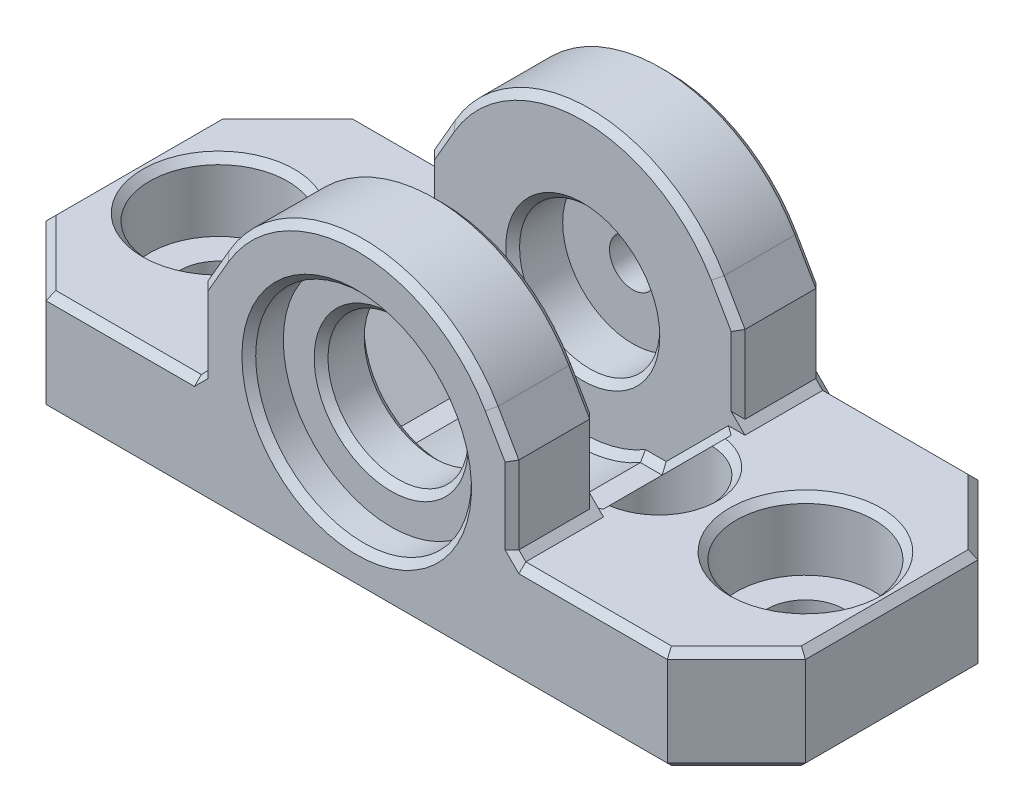
from build123d import *

# Parameters (mm, degrees)
SKETCH1_R                      = 4.0625
BOSS_EXTRUDE1_DEPTH            = 9
SKETCH1_2_R                    = 4.0625
CUT_EXTRUDE1_DEPTH             = 4.1
SKETCH2_W                      = 44
SKETCH2_H                      = 18
BOSS_EXTRUDE2_DEPTH            = 2
SKETCH3_W                      = 13
SKETCH3_H                      = 18
BOSS_EXTRUDE3_DEPTH            = 4
CBORE_FOR_M4_SHCS1_D           = 4.5
CBORE_FOR_M4_SHCS1_CBORE_D     = 8
CBORE_FOR_M4_SHCS1_CBORE_DEPTH = 4
BOSS_EXTRUDE6_REACH            = 38.635
CHAMFER2_SIZE                  = 4
F_6_0MM_DOWEL_HOLE1_D          = 6
CUT_EXTRUDE2_REACH             = 37.377
SKETCH13_R                     = 7.5
CUT_EXTRUDE2_DIRECTION_2_REACH = 37.377
SKETCH19_R                     = 6.25
CUT_EXTRUDE3_DEPTH             = 2
SKETCH20_R                     = 4.0625
SKETCH20_R_2                   = 1.35
BOSS_EXTRUDE5_DEPTH            = 2
CHAMFER8_SIZE                  = 0.4
CHAMFER11_SIZE                 = 0.4
CHAMFER12_SIZE                 = 0.4
CHAMFER14_SIZE                 = 0.4
CHAMFER15_SIZE                 = 0.4


with BuildPart() as part:
    # Sketch1 → Boss-Extrude1 (new, symmetric)
    with BuildSketch(Plane.XY):
        with BuildLine():
            Line((-16.294228634, 11), (-17.5, 8.911542732))
            Line((-17.5, 8.911542732), (-17.5, 0))
            Line((-17.5, 0), (0.5, 0))
            Line((0.5, 0), (0.5, 8.911542732))
            Line((0.5, 8.911542732), (-0.705771366, 11))
            ThreePointArc((-0.705771366, 11), (-8.5, 15.5), (-16.294228634, 11))
        make_face()
        with Locations((-8.5, 6.5)):
            Circle(SKETCH1_R, mode=Mode.SUBTRACT)
    extrude(amount=BOSS_EXTRUDE1_DEPTH, both=True)

    # Sketch1<2> → Cut-Extrude1 (cut, symmetric)
    with BuildSketch(Plane.XY):
        with BuildLine():
            Line((-16.294228634, 11), (-17.5, 8.911542732))
            Line((-17.5, 8.911542732), (-17.5, 0))
            Line((-17.5, 0), (0.5, 0))
            Line((0.5, 0), (0.5, 8.911542732))
            Line((0.5, 8.911542732), (-0.705771366, 11))
            ThreePointArc((-0.705771366, 11), (-8.5, 15.5), (-16.294228634, 11))
        make_face()
        with Locations((-8.5, 6.5)):
            Circle(SKETCH1_2_R, mode=Mode.SUBTRACT)
    extrude(amount=CUT_EXTRUDE1_DEPTH, both=True, mode=Mode.SUBTRACT)


with BuildPart() as cut_extrude1_piece_1:
    # of the separate pieces the step leaves, piece 1, a body of its own (cut_extrude1_pieces)
    add(part.part.solids().sort_by_distance((-0.705771366, 11, -4.1))[0])



with BuildPart() as cut_extrude1_piece_2:
    # of the separate pieces the step leaves, piece 2, a body of its own (cut_extrude1_pieces)
    add(part.part.solids().sort_by_distance((-0.705771366, 11, 9))[0])


with BuildPart() as cut_extrude1_piece_1_1:
    add(cut_extrude1_piece_1.part)

    add(cut_extrude1_piece_2.part)  # Boss-Extrude2 merges Cut-Extrude1 piece 2
    # Sketch2 → Boss-Extrude2 (add)
    with BuildSketch(Plane.XZ):
        with Locations((-8.5, 0)):
            Rectangle(SKETCH2_W, SKETCH2_H)
    extrude(amount=BOSS_EXTRUDE2_DEPTH)

    # Sketch3 → Boss-Extrude3 (add)
    with BuildSketch(Plane(origin=(0, 0, 0), x_dir=(1, 0, 0), z_dir=(0, 1, 0))):
        with Locations((-24, 0)):
            Rectangle(SKETCH3_W, SKETCH3_H)
    boss_extrude3 = extrude(amount=BOSS_EXTRUDE3_DEPTH)

    # Mirror1: Boss-Extrude3 across plane
    add(boss_extrude3.mirror(Plane(origin=(-8.5, 0, 0), x_dir=(0, 0, 1), z_dir=(1, 0, 0))))

    # CBORE for M4 SHCS1 (through all)
    with Locations(Plane(origin=(0, 4, 0), x_dir=(1, 0, 0), z_dir=(0, 1, 0))):
        with Locations((-25.5, 0), (8.5, 0)):
            CounterBoreHole(CBORE_FOR_M4_SHCS1_D / 2, CBORE_FOR_M4_SHCS1_CBORE_D / 2, CBORE_FOR_M4_SHCS1_CBORE_DEPTH)

    # Sketch21 → Boss-Extrude6 (add, up to next)
    with BuildSketch(Plane.XY.offset(-4.1), mode=Mode.PRIVATE) as boss_extrude6_sk1:
        Polygon((-17.5, 4), (-13.5, 0), (-17.5, 0), align=None)
    boss_extrude6_tool1 = extrude(boss_extrude6_sk1.sketch, amount=BOSS_EXTRUDE6_REACH, mode=Mode.PRIVATE) - cut_extrude1_piece_1_1.part
    # Sketch21 → Boss-Extrude6 (add, up to next)
    with BuildSketch(Plane.XY.offset(-4.1), mode=Mode.PRIVATE) as boss_extrude6_sk2:
        Polygon((0.5, 4), (0.5, 0), (-3.5, 0), align=None)
    boss_extrude6_tool2 = extrude(boss_extrude6_sk2.sketch, amount=BOSS_EXTRUDE6_REACH, mode=Mode.PRIVATE) - cut_extrude1_piece_1_1.part
    add(boss_extrude6_tool1.solids().sort_by_distance((-16.166667, 1.333333, -4.1))[0])
    add(boss_extrude6_tool2.solids().sort_by_distance((-0.833333, 1.333333, -4.1))[0])

    # Chamfer2
    chamfer2_edges = [cut_extrude1_piece_1_1.edges().sort_by_distance(p)[0] for p in [
        (-30.5, 1, -9),
        (-30.5, 1, 9),
        (13.5, 1, -9),
        (13.5, 1, 9),
    ]]
    chamfer(chamfer2_edges, length=CHAMFER2_SIZE)

    # Ø6.0mm Dowel Hole1 (through all)
    with Locations(Plane(origin=(0, 4, 0), x_dir=(1, 0, 0), z_dir=(0, 1, 0))):
        with Locations((0, 0)):
            Hole(F_6_0MM_DOWEL_HOLE1_D / 2)

    # Cut-Extrude2: up to this face of the body (flat: up to its plane)
    cut_extrude2_end = Plane(cut_extrude1_piece_1_1.part.faces().sort_by_distance((-0.308600899, 9.837001631, -4.1))[0])
    # Sketch13 → Cut-Extrude2 (cut, up to the picked face)
    with BuildSketch(Plane.XY, mode=Mode.PRIVATE) as cut_extrude2_sk1:
        with Locations((-8.5, 6.5)):
            Circle(SKETCH13_R)
    cut_extrude2_tool1 = split(extrude(cut_extrude2_sk1.sketch, amount=-CUT_EXTRUDE2_REACH, mode=Mode.PRIVATE), bisect_by=cut_extrude2_end, keep=Keep.BOTH, mode=Mode.PRIVATE)
    add(cut_extrude2_tool1.solids().sort_by(Axis((-8.5, 6.5, 0), (0, 0, -1)))[0], mode=Mode.SUBTRACT)

    # Cut-Extrude2 direction 2: up to this face of the body (flat: up to its plane)
    cut_extrude2_direction_2_end = Plane(cut_extrude1_piece_1_1.part.faces().sort_by_distance((-0.308600899, 9.837001631, 4.1))[0])
    # Sketch13 → Cut-Extrude2 direction 2 (cut, up to the picked face)
    with BuildSketch(Plane.XY, mode=Mode.PRIVATE) as cut_extrude2_direction_2_sk1:
        with Locations((-8.5, 6.5)):
            Circle(SKETCH13_R)
    cut_extrude2_direction_2_tool1 = split(extrude(cut_extrude2_direction_2_sk1.sketch, amount=CUT_EXTRUDE2_DIRECTION_2_REACH, mode=Mode.PRIVATE), bisect_by=cut_extrude2_direction_2_end, keep=Keep.BOTH, mode=Mode.PRIVATE)
    add(cut_extrude2_direction_2_tool1.solids().sort_by(Axis((-8.5, 6.5, 0), (0, 0, 1)))[0], mode=Mode.SUBTRACT)

    # Sketch19 → Cut-Extrude3 (cut)
    with BuildSketch(Plane.XY.offset(9)):
        with Locations((-8.5, 6.5)):
            Circle(SKETCH19_R)
    extrude(amount=-CUT_EXTRUDE3_DEPTH, mode=Mode.SUBTRACT)

    # Sketch20 → Boss-Extrude5 (add)
    with BuildSketch(Plane(origin=(0, 0, -9), x_dir=(-1, 0, 0), z_dir=(0, 0, -1))):
        with Locations((8.5, 6.5)):
            Circle(SKETCH20_R)
        with Locations((8.5, 6.5)):
            Circle(SKETCH20_R_2, mode=Mode.SUBTRACT)
    extrude(amount=-BOSS_EXTRUDE5_DEPTH)

    # Chamfer8
    chamfer8_edges = [cut_extrude1_piece_1_1.edges().sort_by_distance(p)[0] for p in [
        (4.5, 4, 0),
        (3, 4, 0),
        (-22, 4, -9),
        (-28.5, 4, -7),
        (-30.5, 4, 0),
        (-28.5, 4, 7),
        (-22, 4, 9),
        (-17.5, 4, -6.55),
        (-17.5, 4, 6.55),
        (-17.5, 6.455771366, 9),
        (-16.897114317, 9.955771366, 9),
        (-8.5, 15.5, 9),
        (-0.102885683, 9.955771366, 9),
        (0.5, 6.455771366, 9),
        (-17.5, 6.455771366, -9),
        (-16.897114317, 9.955771366, -9),
        (-8.5, 15.5, -9),
        (-0.102885683, 9.955771366, -9),
        (0.5, 6.455771366, -9),
        (0.5, 4, -6.55),
        (5, 4, -9),
        (11.5, 4, -7),
        (13.5, 4, 0),
        (11.5, 4, 7),
        (0.5, 4, 6.55),
        (5, 4, 9),
        (-29.5, 4, 0),
    ]]
    chamfer(chamfer8_edges, length=CHAMFER8_SIZE)

    # Chamfer11
    chamfer11_edges = [cut_extrude1_piece_1_1.edges().sort_by_distance(p)[0] for p in [
        (-12.5625, 6.5, 7),
        (-12.5625, 6.5, 4.1),
        (-14.75, 6.5, 9),
        (-12.5625, 6.5, -4.1),
    ]]
    chamfer(chamfer11_edges, length=CHAMFER11_SIZE)

    # Chamfer12
    chamfer12_edges = [cut_extrude1_piece_1_1.edges().sort_by_distance(p)[0] for p in [
        (-28.5, -2, -7),
        (-30.5, -2, 0),
        (-28.5, -2, 7),
        (-8.5, -2, 9),
        (11.5, -2, 7),
        (13.5, -2, 0),
        (11.5, -2, -7),
        (-8.5, -2, -9),
        (10.75, -2, 0),
        (-23.25, -2, 0),
        (3, -2, 0),
    ]]
    chamfer(chamfer12_edges, length=CHAMFER12_SIZE)

    # Chamfer14
    chamfer14_edges = [cut_extrude1_piece_1_1.edges().sort_by_distance(p)[0] for p in [
        (0.5, 6.655771366, 4.1),
        (-0.102885683, 9.955771366, 4.1),
        (-8.5, 15.5, 4.1),
        (-16.897114317, 9.955771366, 4.1),
        (-17.5, 6.655771366, 4.1),
        (0.5, 6.655771366, -4.1),
        (-17.5, 6.655771366, -4.1),
        (-0.102885683, 9.955771366, -4.1),
        (-8.5, 15.5, -4.1),
        (-16.897114317, 9.955771366, -4.1),
    ]]
    chamfer(chamfer14_edges, length=CHAMFER14_SIZE)

    # Chamfer15
    chamfer15_edges = [cut_extrude1_piece_1_1.edges().sort_by_distance(p)[0] for p in [
        (-1.5, 2, -4.1),
        (-4.129171307, 0, -4.1),
        (-8.5, -1, -4.1),
        (-12.870828693, 0, -4.1),
        (-15.5, 2, -4.1),
        (-1.5, 2, 4.1),
        (-4.129171307, 0, 4.1),
        (-8.5, -1, 4.1),
        (-12.870828693, 0, 4.1),
        (-15.5, 2, 4.1),
    ]]
    chamfer(chamfer15_edges, length=CHAMFER15_SIZE)


solid = cut_extrude1_piece_1_1.part
